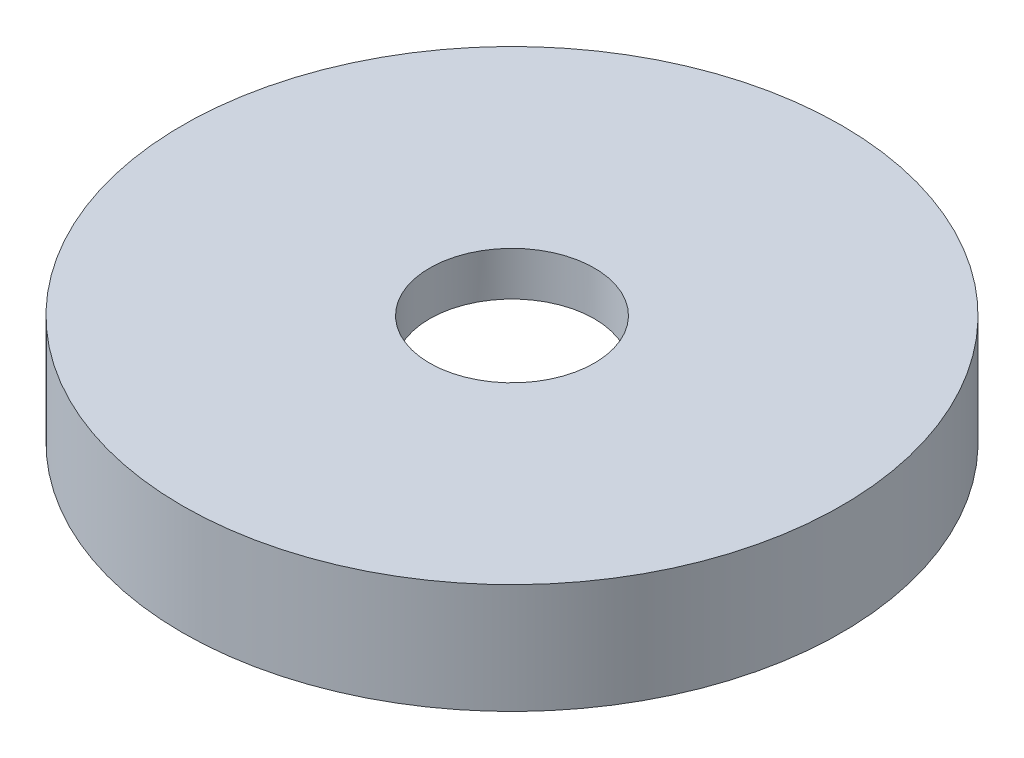
from build123d import *

# Parameters (mm, degrees)
ESQUISSE1_R             = 30
BOSS_EXTRU_1_DEPTH      = 10
ESQUISSE2_R             = 17.5
ENL_V_MAT_EXTRU_1_DEPTH = 6
ESQUISSE3_R             = 7.5
ENL_V_MAT_EXTRU_2_DEPTH = 44.588989435


with BuildPart() as part:
    # Esquisse1 → Boss.-Extru.1 (new body)
    with BuildSketch(Plane(origin=(0, 0, 0), x_dir=(1, 0, 0), z_dir=(0, 1, 0))):
        Circle(ESQUISSE1_R)
    extrude(amount=BOSS_EXTRU_1_DEPTH)

    # Esquisse2 → Enlèv. mat.-Extru.1 (cut)
    with BuildSketch(Plane.XZ):
        Circle(ESQUISSE2_R)
    extrude(amount=-ENL_V_MAT_EXTRU_1_DEPTH, mode=Mode.SUBTRACT)

    # Esquisse3 → Enlèv. mat.-Extru.2 (cut, through all)
    with BuildSketch(Plane(origin=(0, 10, 0), x_dir=(1, 0, 0), z_dir=(0, 1, 0))):
        Circle(ESQUISSE3_R)
    extrude(amount=-ENL_V_MAT_EXTRU_2_DEPTH, mode=Mode.SUBTRACT)


solid = part.part
